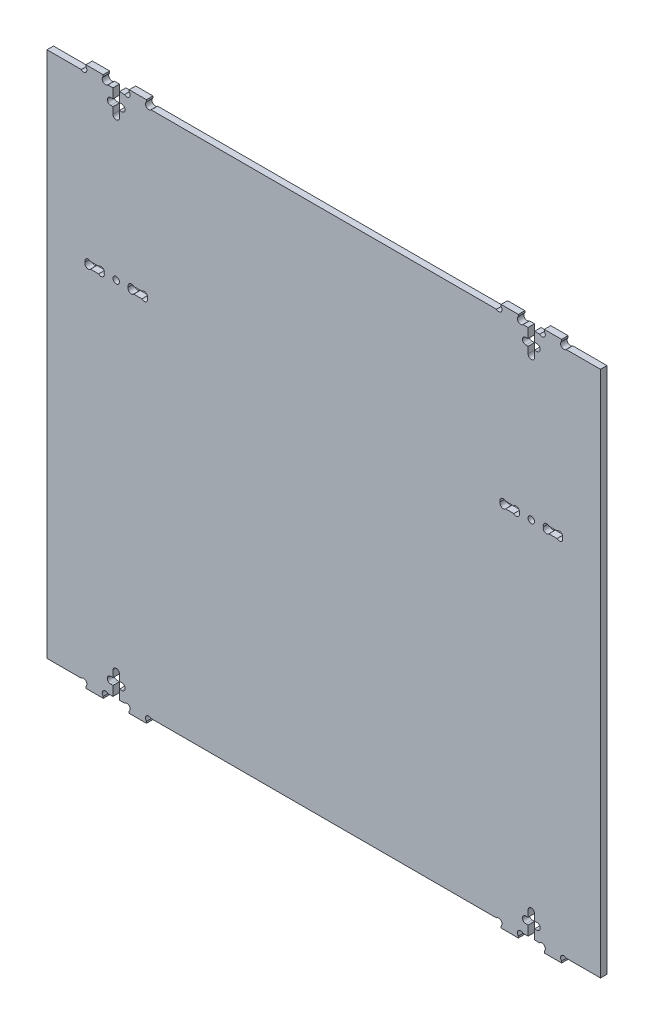
from build123d import *

# Parameters (mm, degrees)
SKETCH_1_W                      = 524
SKETCH_1_H                      = 499.6
EXTRUDE_1_DEPTH                 = 6
CUT_EXTRUDE_5_DEPTH             = 720.897881647
CUT_EXTRUDE_5_DEPTH_BACK        = 720.897881647
SKETCH_5_R                      = 2.75
SKETCH_5_W                      = 328
SKETCH_5_H                      = 6
SKETCH_5_W_2                    = 16.15
SKETCH_5_H_2                    = 6.15
CUT_EXTRUDE_6_01_DEPTH          = 716.54242362
CUT_EXTRUDE_6_01_DEPTH_BACK     = 716.54242362
SKETCH_6_01_W                   = 6
SKETCH_6_01_H                   = 21.2
CUT_EXTRUDE_6_01_2_DEPTH        = 716.54242362
CUT_EXTRUDE_6_01_2_DEPTH_BACK   = 716.54242362
SKETCH_6_01_2_W                 = 10.3
SKETCH_6_01_2_H                 = 6.2
CUT_EXTRUDE_6_01_1_DEPTH        = 716.54242362
CUT_EXTRUDE_6_01_1_DEPTH_BACK   = 716.54242362
SKETCH_6_01_1_R                 = 3.05
CUT_EXTRUDE_6_01_1_2_DEPTH      = 716.54242362
CUT_EXTRUDE_6_01_1_2_DEPTH_BACK = 716.54242362
SKETCH_6_01_1_2_R               = 3.05
CUT_EXTRUDE_6_01_3_DEPTH        = 716.54242362
CUT_EXTRUDE_6_01_3_DEPTH_BACK   = 716.54242362
SKETCH_6_01_3_R                 = 3
CUT_EXTRUDE_6_02_DEPTH          = 716.54242362
CUT_EXTRUDE_6_02_DEPTH_BACK     = 716.54242362
SKETCH_6_02_W                   = 6
SKETCH_6_02_H                   = 21.2
CUT_EXTRUDE_6_02_2_DEPTH        = 716.54242362
CUT_EXTRUDE_6_02_2_DEPTH_BACK   = 716.54242362
SKETCH_6_02_2_W                 = 10.3
SKETCH_6_02_2_H                 = 6.2
CUT_EXTRUDE_6_02_1_DEPTH        = 716.54242362
CUT_EXTRUDE_6_02_1_DEPTH_BACK   = 716.54242362
SKETCH_6_02_1_R                 = 3.05
CUT_EXTRUDE_6_02_1_2_DEPTH      = 716.54242362
CUT_EXTRUDE_6_02_1_2_DEPTH_BACK = 716.54242362
SKETCH_6_02_1_2_R               = 3.05
CUT_EXTRUDE_6_02_3_DEPTH        = 716.54242362
CUT_EXTRUDE_6_02_3_DEPTH_BACK   = 716.54242362
SKETCH_6_02_3_R                 = 3
CUT_EXTRUDE_6_03_DEPTH          = 716.54242362
CUT_EXTRUDE_6_03_DEPTH_BACK     = 716.54242362
SKETCH_6_03_W                   = 6
SKETCH_6_03_H                   = 21.2
CUT_EXTRUDE_6_03_2_DEPTH        = 716.54242362
CUT_EXTRUDE_6_03_2_DEPTH_BACK   = 716.54242362
SKETCH_6_03_2_W                 = 10.3
SKETCH_6_03_2_H                 = 6.2
CUT_EXTRUDE_6_03_1_DEPTH        = 716.54242362
CUT_EXTRUDE_6_03_1_DEPTH_BACK   = 716.54242362
SKETCH_6_03_1_R                 = 3.05
CUT_EXTRUDE_6_03_1_2_DEPTH      = 716.54242362
CUT_EXTRUDE_6_03_1_2_DEPTH_BACK = 716.54242362
SKETCH_6_03_1_2_R               = 3.05
CUT_EXTRUDE_6_03_3_DEPTH        = 716.54242362
CUT_EXTRUDE_6_03_3_DEPTH_BACK   = 716.54242362
SKETCH_6_03_3_R                 = 3
CUT_EXTRUDE_6_04_DEPTH          = 716.54242362
CUT_EXTRUDE_6_04_DEPTH_BACK     = 716.54242362
SKETCH_6_04_W                   = 6
SKETCH_6_04_H                   = 21.2
CUT_EXTRUDE_6_04_2_DEPTH        = 716.54242362
CUT_EXTRUDE_6_04_2_DEPTH_BACK   = 716.54242362
SKETCH_6_04_2_W                 = 10.3
SKETCH_6_04_2_H                 = 6.2
CUT_EXTRUDE_6_04_1_DEPTH        = 716.54242362
CUT_EXTRUDE_6_04_1_DEPTH_BACK   = 716.54242362
SKETCH_6_04_1_R                 = 3.05
CUT_EXTRUDE_6_04_1_2_DEPTH      = 716.54242362
CUT_EXTRUDE_6_04_1_2_DEPTH_BACK = 716.54242362
SKETCH_6_04_1_2_R               = 3.05
CUT_EXTRUDE_6_04_3_DEPTH        = 716.54242362
CUT_EXTRUDE_6_04_3_DEPTH_BACK   = 716.54242362
SKETCH_6_04_3_R                 = 3
CUT_EXTRUDE_01_DEPTH            = 716.54242362
CUT_EXTRUDE_01_DEPTH_BACK       = 716.54242362
SKETCH_01_R                     = 3.05
CUT_EXTRUDE_02_DEPTH            = 716.54242362
CUT_EXTRUDE_02_DEPTH_BACK       = 716.54242362
SKETCH_02_R                     = 3.05
CUT_EXTRUDE_03_DEPTH            = 716.54242362
CUT_EXTRUDE_03_DEPTH_BACK       = 716.54242362
SKETCH_03_R                     = 3.05
CUT_EXTRUDE_04_DEPTH            = 716.54242362
CUT_EXTRUDE_04_DEPTH_BACK       = 716.54242362
SKETCH_04_R                     = 3.05
SKETCH_6_01_4_R                 = 10
EXTRUDE_6_01_20_DEPTH           = 6
CUT_EXTRUDE_6_01_4_DEPTH        = 716.54242362
CUT_EXTRUDE_6_01_4_DEPTH_BACK   = 716.54242362
SKETCH_6_01_5_R                 = 3
SKETCH_6_02_4_R                 = 10
EXTRUDE_6_02_20_DEPTH           = 6
CUT_EXTRUDE_6_02_4_DEPTH        = 716.54242362
CUT_EXTRUDE_6_02_4_DEPTH_BACK   = 716.54242362
SKETCH_6_02_5_R                 = 3


with BuildPart() as part:
    # Эскиз1 → Бобышка-Вытянуть1 (new body)
    with BuildSketch(Plane.XY):
        with Locations((-262, -243.8)):
            Rectangle(SKETCH_1_W, SKETCH_1_H)
    extrude(amount=-EXTRUDE_1_DEPTH)

    # Стыки_эскиз_пазов_и_стяжек_М5 → Стыки_шип_паз_стяжки_М5 (cut, two sides: drawn at the far end of the back side and taken through both)
    with BuildSketch(Plane.XY.offset(-CUT_EXTRUDE_5_DEPTH_BACK)):
        with Locations((-454, -152.6)):
            Circle(SKETCH_5_R)
        with Locations((-70, -152.6)):
            Circle(SKETCH_5_R)
        Polygon((-524.1, 6), (-524.1, 0), (-524, 0), (-524, -487.6), (-524.1, -487.6), (-524.1, -493.6), (-482, -493.6), (-482, -487.6), (-518, -487.6), (-518, 0), (-482, 0), (-482, 6), align=None)
        Polygon((0, 0), (0.1, 0), (0.1, 6), (-42, 6), (-42, 0), (-6, 0), (-6, -487.6), (-42, -487.6), (-42, -493.6), (0.1, -493.6), (0.1, -487.6), (0, -487.6), align=None)
        Polygon((-67.25, 0), (-58, 0), (-58, 6), (-67.25, 6), (-67.25, 6.1), (-72.75, 6.1), (-72.75, 6), (-82, 6), (-82, 0), (-72.75, 0), (-72.75, -9.85), (-74.15, -9.85), (-74.15, -14.15), (-72.75, -14.15), (-72.75, -21), (-67.25, -21), (-67.25, -14.15), (-65.85, -14.15), (-65.85, -9.85), (-67.25, -9.85), align=None)
        with Locations((-262, -490.6)):
            Rectangle(SKETCH_5_W, SKETCH_5_H)
        with Locations((-90, -152.6)):
            Rectangle(SKETCH_5_W_2, SKETCH_5_H_2)
        Polygon((-456.75, -21), (-451.25, -21), (-451.25, -14.15), (-449.85, -14.15), (-449.85, -9.85), (-451.25, -9.85), (-451.25, 0), (-442, 0), (-442, 6), (-451.25, 6), (-451.25, 6.1), (-456.75, 6.1), (-456.75, 6), (-466, 6), (-466, 0), (-456.75, 0), (-456.75, -9.85), (-458.15, -9.85), (-458.15, -14.15), (-456.75, -14.15), align=None)
        Polygon((-72.75, -493.6), (-72.75, -493.7), (-67.25, -493.7), (-67.25, -493.6), (-58, -493.6), (-58, -487.6), (-67.25, -487.6), (-67.25, -477.75), (-65.85, -477.75), (-65.85, -473.45), (-67.25, -473.45), (-67.25, -466.6), (-72.75, -466.6), (-72.75, -473.45), (-74.15, -473.45), (-74.15, -477.75), (-72.75, -477.75), (-72.75, -487.6), (-82, -487.6), (-82, -493.6), align=None)
        with Locations((-50, -152.6)):
            Rectangle(SKETCH_5_W_2, SKETCH_5_H_2)
        with Locations((-474, -152.6)):
            Rectangle(SKETCH_5_W_2, SKETCH_5_H_2)
        with Locations((-262, 3)):
            Rectangle(SKETCH_5_W, SKETCH_5_H)
        Polygon((-456.75, -493.7), (-451.25, -493.7), (-451.25, -493.6), (-442, -493.6), (-442, -487.6), (-451.25, -487.6), (-451.25, -477.75), (-449.85, -477.75), (-449.85, -473.45), (-451.25, -473.45), (-451.25, -466.6), (-456.75, -466.6), (-456.75, -473.45), (-458.15, -473.45), (-458.15, -477.75), (-456.75, -477.75), (-456.75, -487.6), (-466, -487.6), (-466, -493.6), (-456.75, -493.6), align=None)
        with Locations((-434, -152.6)):
            Rectangle(SKETCH_5_W_2, SKETCH_5_H_2)
    extrude(amount=CUT_EXTRUDE_5_DEPTH + CUT_EXTRUDE_5_DEPTH_BACK, mode=Mode.SUBTRACT)

    # Sketch 6_01 → Cut-Extrude 6_01 (cut, two sides: drawn at the far end of the back side and taken through both)
    with BuildSketch(Plane.XY.offset(-CUT_EXTRUDE_6_01_DEPTH_BACK)):
        with Locations((-454, -477.1)):
            Rectangle(SKETCH_6_01_W, SKETCH_6_01_H)
    extrude(amount=CUT_EXTRUDE_6_01_DEPTH + CUT_EXTRUDE_6_01_DEPTH_BACK, mode=Mode.SUBTRACT)

    # Sketch 6_01 2 → Cut-Extrude 6_01 2 (cut, two sides: drawn at the far end of the back side and taken through both)
    with BuildSketch(Plane.XY.offset(-CUT_EXTRUDE_6_01_2_DEPTH_BACK)):
        with Locations((-454, -475.6)):
            Rectangle(SKETCH_6_01_2_W, SKETCH_6_01_2_H)
    extrude(amount=CUT_EXTRUDE_6_01_2_DEPTH + CUT_EXTRUDE_6_01_2_DEPTH_BACK, mode=Mode.SUBTRACT)

    # Sketch 6_01_____1 → Cut-Extrude 6_01_____1 (cut, two sides: drawn at the far end of the back side and taken through both)
    with BuildSketch(Plane.XY.offset(-CUT_EXTRUDE_6_01_1_DEPTH_BACK)):
        with Locations((-448.85, -475.55)):
            Circle(SKETCH_6_01_1_R)
        with Locations((-459.15, -475.55)):
            Circle(SKETCH_6_01_1_R)
    extrude(amount=CUT_EXTRUDE_6_01_1_DEPTH + CUT_EXTRUDE_6_01_1_DEPTH_BACK, mode=Mode.SUBTRACT)

    # Sketch 6_01_____-1 2 → Cut-Extrude 6_01_____-1 2 (cut, two sides: drawn at the far end of the back side and taken through both)
    with BuildSketch(Plane.XY.offset(-CUT_EXTRUDE_6_01_1_2_DEPTH_BACK)):
        with Locations((-448.85, -475.65)):
            Circle(SKETCH_6_01_1_2_R)
        with Locations((-459.15, -475.65)):
            Circle(SKETCH_6_01_1_2_R)
    extrude(amount=CUT_EXTRUDE_6_01_1_2_DEPTH + CUT_EXTRUDE_6_01_1_2_DEPTH_BACK, mode=Mode.SUBTRACT)

    # Sketch 6_01 3 → Cut-Extrude 6_01 3 (cut, two sides: drawn at the far end of the back side and taken through both)
    with BuildSketch(Plane.XY.offset(-CUT_EXTRUDE_6_01_3_DEPTH_BACK)):
        with Locations((-454, -466.5)):
            Circle(SKETCH_6_01_3_R)
    extrude(amount=CUT_EXTRUDE_6_01_3_DEPTH + CUT_EXTRUDE_6_01_3_DEPTH_BACK, mode=Mode.SUBTRACT)

    # Sketch 6_02 → Cut-Extrude 6_02 (cut, two sides: drawn at the far end of the back side and taken through both)
    with BuildSketch(Plane.XY.offset(-CUT_EXTRUDE_6_02_DEPTH_BACK)):
        with Locations((-70, -477.1)):
            Rectangle(SKETCH_6_02_W, SKETCH_6_02_H)
    extrude(amount=CUT_EXTRUDE_6_02_DEPTH + CUT_EXTRUDE_6_02_DEPTH_BACK, mode=Mode.SUBTRACT)

    # Sketch 6_02 2 → Cut-Extrude 6_02 2 (cut, two sides: drawn at the far end of the back side and taken through both)
    with BuildSketch(Plane.XY.offset(-CUT_EXTRUDE_6_02_2_DEPTH_BACK)):
        with Locations((-70, -475.6)):
            Rectangle(SKETCH_6_02_2_W, SKETCH_6_02_2_H)
    extrude(amount=CUT_EXTRUDE_6_02_2_DEPTH + CUT_EXTRUDE_6_02_2_DEPTH_BACK, mode=Mode.SUBTRACT)

    # Sketch 6_02_____1 → Cut-Extrude 6_02_____1 (cut, two sides: drawn at the far end of the back side and taken through both)
    with BuildSketch(Plane.XY.offset(-CUT_EXTRUDE_6_02_1_DEPTH_BACK)):
        with Locations((-64.85, -475.55)):
            Circle(SKETCH_6_02_1_R)
        with Locations((-75.15, -475.55)):
            Circle(SKETCH_6_02_1_R)
    extrude(amount=CUT_EXTRUDE_6_02_1_DEPTH + CUT_EXTRUDE_6_02_1_DEPTH_BACK, mode=Mode.SUBTRACT)

    # Sketch 6_02_____-1 2 → Cut-Extrude 6_02_____-1 2 (cut, two sides: drawn at the far end of the back side and taken through both)
    with BuildSketch(Plane.XY.offset(-CUT_EXTRUDE_6_02_1_2_DEPTH_BACK)):
        with Locations((-64.85, -475.65)):
            Circle(SKETCH_6_02_1_2_R)
        with Locations((-75.15, -475.65)):
            Circle(SKETCH_6_02_1_2_R)
    extrude(amount=CUT_EXTRUDE_6_02_1_2_DEPTH + CUT_EXTRUDE_6_02_1_2_DEPTH_BACK, mode=Mode.SUBTRACT)

    # Sketch 6_02 3 → Cut-Extrude 6_02 3 (cut, two sides: drawn at the far end of the back side and taken through both)
    with BuildSketch(Plane.XY.offset(-CUT_EXTRUDE_6_02_3_DEPTH_BACK)):
        with Locations((-70, -466.5)):
            Circle(SKETCH_6_02_3_R)
    extrude(amount=CUT_EXTRUDE_6_02_3_DEPTH + CUT_EXTRUDE_6_02_3_DEPTH_BACK, mode=Mode.SUBTRACT)

    # Sketch 6_03 → Cut-Extrude 6_03 (cut, two sides: drawn at the far end of the back side and taken through both)
    with BuildSketch(Plane.XY.offset(-CUT_EXTRUDE_6_03_DEPTH_BACK)):
        with Locations((-70, -10.5)):
            Rectangle(SKETCH_6_03_W, SKETCH_6_03_H)
    extrude(amount=CUT_EXTRUDE_6_03_DEPTH + CUT_EXTRUDE_6_03_DEPTH_BACK, mode=Mode.SUBTRACT)

    # Sketch 6_03 2 → Cut-Extrude 6_03 2 (cut, two sides: drawn at the far end of the back side and taken through both)
    with BuildSketch(Plane.XY.offset(-CUT_EXTRUDE_6_03_2_DEPTH_BACK)):
        with Locations((-70, -12)):
            Rectangle(SKETCH_6_03_2_W, SKETCH_6_03_2_H)
    extrude(amount=CUT_EXTRUDE_6_03_2_DEPTH + CUT_EXTRUDE_6_03_2_DEPTH_BACK, mode=Mode.SUBTRACT)

    # Sketch 6_03_____1 → Cut-Extrude 6_03_____1 (cut, two sides: drawn at the far end of the back side and taken through both)
    with BuildSketch(Plane.XY.offset(-CUT_EXTRUDE_6_03_1_DEPTH_BACK)):
        with Locations((-64.85, -11.95)):
            Circle(SKETCH_6_03_1_R)
        with Locations((-75.15, -11.95)):
            Circle(SKETCH_6_03_1_R)
    extrude(amount=CUT_EXTRUDE_6_03_1_DEPTH + CUT_EXTRUDE_6_03_1_DEPTH_BACK, mode=Mode.SUBTRACT)

    # Sketch 6_03_____-1 2 → Cut-Extrude 6_03_____-1 2 (cut, two sides: drawn at the far end of the back side and taken through both)
    with BuildSketch(Plane.XY.offset(-CUT_EXTRUDE_6_03_1_2_DEPTH_BACK)):
        with Locations((-64.85, -12.05)):
            Circle(SKETCH_6_03_1_2_R)
        with Locations((-75.15, -12.05)):
            Circle(SKETCH_6_03_1_2_R)
    extrude(amount=CUT_EXTRUDE_6_03_1_2_DEPTH + CUT_EXTRUDE_6_03_1_2_DEPTH_BACK, mode=Mode.SUBTRACT)

    # Sketch 6_03 3 → Cut-Extrude 6_03 3 (cut, two sides: drawn at the far end of the back side and taken through both)
    with BuildSketch(Plane.XY.offset(-CUT_EXTRUDE_6_03_3_DEPTH_BACK)):
        with Locations((-70, -21.1)):
            Circle(SKETCH_6_03_3_R)
    extrude(amount=CUT_EXTRUDE_6_03_3_DEPTH + CUT_EXTRUDE_6_03_3_DEPTH_BACK, mode=Mode.SUBTRACT)

    # Sketch 6_04 → Cut-Extrude 6_04 (cut, two sides: drawn at the far end of the back side and taken through both)
    with BuildSketch(Plane.XY.offset(-CUT_EXTRUDE_6_04_DEPTH_BACK)):
        with Locations((-454, -10.5)):
            Rectangle(SKETCH_6_04_W, SKETCH_6_04_H)
    extrude(amount=CUT_EXTRUDE_6_04_DEPTH + CUT_EXTRUDE_6_04_DEPTH_BACK, mode=Mode.SUBTRACT)

    # Sketch 6_04 2 → Cut-Extrude 6_04 2 (cut, two sides: drawn at the far end of the back side and taken through both)
    with BuildSketch(Plane.XY.offset(-CUT_EXTRUDE_6_04_2_DEPTH_BACK)):
        with Locations((-454, -12)):
            Rectangle(SKETCH_6_04_2_W, SKETCH_6_04_2_H)
    extrude(amount=CUT_EXTRUDE_6_04_2_DEPTH + CUT_EXTRUDE_6_04_2_DEPTH_BACK, mode=Mode.SUBTRACT)

    # Sketch 6_04_____1 → Cut-Extrude 6_04_____1 (cut, two sides: drawn at the far end of the back side and taken through both)
    with BuildSketch(Plane.XY.offset(-CUT_EXTRUDE_6_04_1_DEPTH_BACK)):
        with Locations((-448.85, -11.95)):
            Circle(SKETCH_6_04_1_R)
        with Locations((-459.15, -11.95)):
            Circle(SKETCH_6_04_1_R)
    extrude(amount=CUT_EXTRUDE_6_04_1_DEPTH + CUT_EXTRUDE_6_04_1_DEPTH_BACK, mode=Mode.SUBTRACT)

    # Sketch 6_04_____-1 2 → Cut-Extrude 6_04_____-1 2 (cut, two sides: drawn at the far end of the back side and taken through both)
    with BuildSketch(Plane.XY.offset(-CUT_EXTRUDE_6_04_1_2_DEPTH_BACK)):
        with Locations((-448.85, -12.05)):
            Circle(SKETCH_6_04_1_2_R)
        with Locations((-459.15, -12.05)):
            Circle(SKETCH_6_04_1_2_R)
    extrude(amount=CUT_EXTRUDE_6_04_1_2_DEPTH + CUT_EXTRUDE_6_04_1_2_DEPTH_BACK, mode=Mode.SUBTRACT)

    # Sketch 6_04 3 → Cut-Extrude 6_04 3 (cut, two sides: drawn at the far end of the back side and taken through both)
    with BuildSketch(Plane.XY.offset(-CUT_EXTRUDE_6_04_3_DEPTH_BACK)):
        with Locations((-454, -21.1)):
            Circle(SKETCH_6_04_3_R)
    extrude(amount=CUT_EXTRUDE_6_04_3_DEPTH + CUT_EXTRUDE_6_04_3_DEPTH_BACK, mode=Mode.SUBTRACT)

    # ЧПУ_Шаблон_углов_01 → ЧПУ_Разгрузки_01 (cut, two sides: drawn at the far end of the back side and taken through both)
    with BuildSketch(Plane.XY.offset(-CUT_EXTRUDE_01_DEPTH_BACK)):
        with Locations((-484.121320344, 2.121320344)):
            Circle(SKETCH_01_R)
        with Locations((-60.121320344, 2.121320344)):
            Circle(SKETCH_01_R)
        with Locations((-100.121320344, 2.121320344)):
            Circle(SKETCH_01_R)
        with Locations((-444.121320344, 2.121320344)):
            Circle(SKETCH_01_R)
        with Locations((-44.046320344, -153.553679656)):
            Circle(SKETCH_01_R)
        with Locations((-468.046320344, -153.553679656)):
            Circle(SKETCH_01_R)
        with Locations((-84.046320344, -153.553679656)):
            Circle(SKETCH_01_R)
        with Locations((-428.046320344, -153.553679656)):
            Circle(SKETCH_01_R)
    extrude(amount=CUT_EXTRUDE_01_DEPTH + CUT_EXTRUDE_01_DEPTH_BACK, mode=Mode.SUBTRACT)

    # ЧПУ_Шаблон_углов_02 → ЧПУ_Разгрузки_02 (cut, two sides: drawn at the far end of the back side and taken through both)
    with BuildSketch(Plane.XY.offset(-CUT_EXTRUDE_02_DEPTH_BACK)):
        with Locations((-484.121320344, -489.721320344)):
            Circle(SKETCH_02_R)
        with Locations((-444.121320344, -489.721320344)):
            Circle(SKETCH_02_R)
        with Locations((-100.121320344, -489.721320344)):
            Circle(SKETCH_02_R)
        with Locations((-60.121320344, -489.721320344)):
            Circle(SKETCH_02_R)
        with Locations((-44.046320344, -151.646320344)):
            Circle(SKETCH_02_R)
        with Locations((-468.046320344, -151.646320344)):
            Circle(SKETCH_02_R)
        with Locations((-84.046320344, -151.646320344)):
            Circle(SKETCH_02_R)
        with Locations((-428.046320344, -151.646320344)):
            Circle(SKETCH_02_R)
    extrude(amount=CUT_EXTRUDE_02_DEPTH + CUT_EXTRUDE_02_DEPTH_BACK, mode=Mode.SUBTRACT)

    # ЧПУ_Шаблон_углов_03 → ЧПУ_Разгрузки_03 (cut, two sides: drawn at the far end of the back side and taken through both)
    with BuildSketch(Plane.XY.offset(-CUT_EXTRUDE_03_DEPTH_BACK)):
        with Locations((-463.878679656, -489.721320344)):
            Circle(SKETCH_03_R)
        with Locations((-423.878679656, -489.721320344)):
            Circle(SKETCH_03_R)
        with Locations((-79.878679656, -489.721320344)):
            Circle(SKETCH_03_R)
        with Locations((-39.878679656, -489.721320344)):
            Circle(SKETCH_03_R)
        with Locations((-55.953679656, -151.646320344)):
            Circle(SKETCH_03_R)
        with Locations((-479.953679656, -151.646320344)):
            Circle(SKETCH_03_R)
        with Locations((-95.953679656, -151.646320344)):
            Circle(SKETCH_03_R)
        with Locations((-439.953679656, -151.646320344)):
            Circle(SKETCH_03_R)
    extrude(amount=CUT_EXTRUDE_03_DEPTH + CUT_EXTRUDE_03_DEPTH_BACK, mode=Mode.SUBTRACT)

    # ЧПУ_Шаблон_углов_04 → ЧПУ_Разгрузки_04 (cut, two sides: drawn at the far end of the back side and taken through both)
    with BuildSketch(Plane.XY.offset(-CUT_EXTRUDE_04_DEPTH_BACK)):
        with Locations((-39.878679656, 2.121320344)):
            Circle(SKETCH_04_R)
        with Locations((-79.878679656, 2.121320344)):
            Circle(SKETCH_04_R)
        with Locations((-423.878679656, 2.121320344)):
            Circle(SKETCH_04_R)
        with Locations((-463.878679656, 2.121320344)):
            Circle(SKETCH_04_R)
        with Locations((-55.953679656, -153.553679656)):
            Circle(SKETCH_04_R)
        with Locations((-479.953679656, -153.553679656)):
            Circle(SKETCH_04_R)
        with Locations((-95.953679656, -153.553679656)):
            Circle(SKETCH_04_R)
        with Locations((-439.953679656, -153.553679656)):
            Circle(SKETCH_04_R)
    extrude(amount=CUT_EXTRUDE_04_DEPTH + CUT_EXTRUDE_04_DEPTH_BACK, mode=Mode.SUBTRACT)

    # Sketch 6_01 4 → ЧПУ_Проход_М6_01_Ушко20 (add)
    with BuildSketch(Plane.XY):
        with Locations((-454, -152.6)):
            Circle(SKETCH_6_01_4_R)
    extrude(amount=-EXTRUDE_6_01_20_DEPTH)

    # Sketch 6_01 5 → Cut-Extrude 6_01 4 (cut, two sides: drawn at the far end of the back side and taken through both)
    with BuildSketch(Plane.XY.offset(-CUT_EXTRUDE_6_01_4_DEPTH_BACK)):
        with Locations((-454, -152.6)):
            Circle(SKETCH_6_01_5_R)
    extrude(amount=CUT_EXTRUDE_6_01_4_DEPTH + CUT_EXTRUDE_6_01_4_DEPTH_BACK, mode=Mode.SUBTRACT)

    # Sketch 6_02 4 → ЧПУ_Проход_М6_02_Ушко20 (add)
    with BuildSketch(Plane.XY):
        with Locations((-70, -152.6)):
            Circle(SKETCH_6_02_4_R)
    extrude(amount=-EXTRUDE_6_02_20_DEPTH)

    # Sketch 6_02 5 → Cut-Extrude 6_02 4 (cut, two sides: drawn at the far end of the back side and taken through both)
    with BuildSketch(Plane.XY.offset(-CUT_EXTRUDE_6_02_4_DEPTH_BACK)):
        with Locations((-70, -152.6)):
            Circle(SKETCH_6_02_5_R)
    extrude(amount=CUT_EXTRUDE_6_02_4_DEPTH + CUT_EXTRUDE_6_02_4_DEPTH_BACK, mode=Mode.SUBTRACT)


solid = part.part
